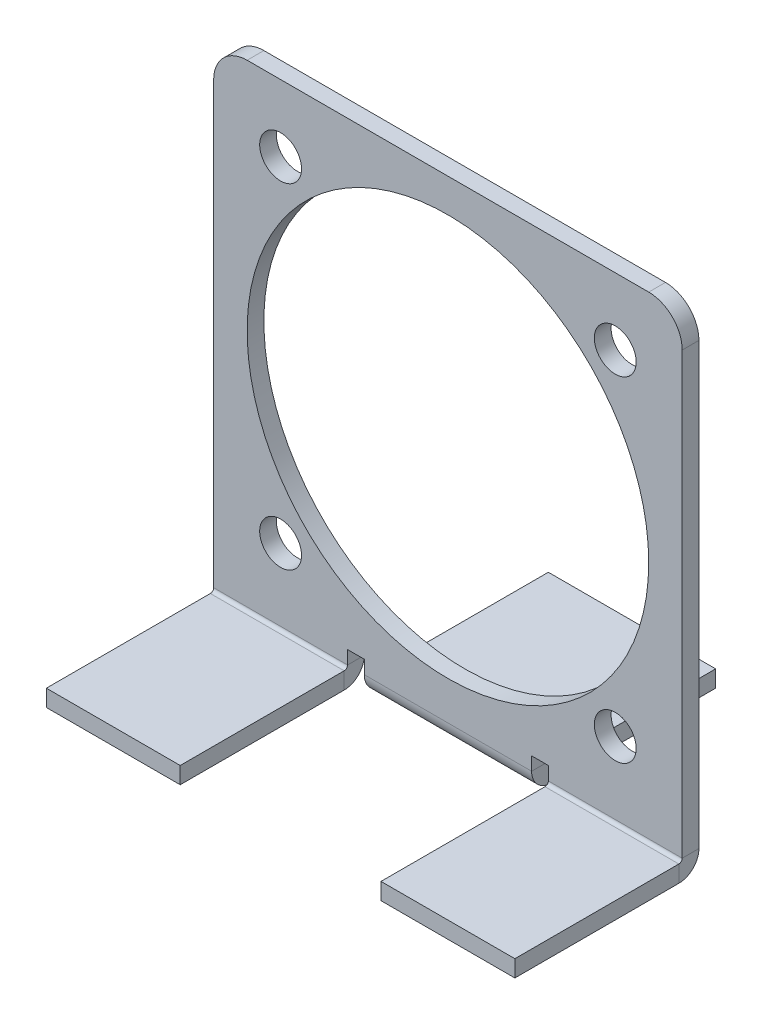
from build123d import *

# Parameters (mm, degrees)
SKIZZE1_W                       = 28
SKIZZE1_H                       = 29.5
SKIZZE1_R                       = 1.25
SKIZZE1_R_2                     = 12
BASIS_BLECH1_DEPTH              = 1
VERRUNDUNG1_R                   = 2
SKIZZE9_W                       = 1
SKIZZE9_H                       = 2
SCHNITT_LINEAR_AUSTRAGEN1_DEPTH = 33.668792448
KANTE_LASCHE2_STRIP_W           = 4.4
KANTE_LASCHE2_STRIP_H           = 1
KANTE_LASCHE2_STRIP_CUT_DEPTH   = 8
KANTE_LASCHE2_STRIP_2_W         = 4.4
KANTE_LASCHE2_STRIP_2_H         = 1
KANTE_LASCHE2_STRIP_CUT_2_DEPTH = 8
KANTE_LASCHE2_DEPTH             = 8
KANTE_LASCHE2_BEND_DEPTH        = 8
KANTE_LASCHE3_STRIP_W           = 4.4
KANTE_LASCHE3_STRIP_H           = 1
KANTE_LASCHE3_STRIP_CUT_DEPTH   = 10
KANTE_LASCHE3_DEPTH             = 10


# Sheet-metal steps are written as plain solids
with BuildPart() as part:
    # Skizze1 → Basis-Blech1 (new body)
    with BuildSketch(Plane.XY):
        with Locations((0, 14.75)):
            Rectangle(SKIZZE1_W, SKIZZE1_H)
        with Locations((-10, 25.5)):
            Circle(SKIZZE1_R, mode=Mode.SUBTRACT)
        with Locations((10, 25.5)):
            Circle(SKIZZE1_R, mode=Mode.SUBTRACT)
        with Locations((10, 5.5)):
            Circle(SKIZZE1_R, mode=Mode.SUBTRACT)
        with Locations((-10, 5.5)):
            Circle(SKIZZE1_R, mode=Mode.SUBTRACT)
        with Locations((0, 15.5)):
            Circle(SKIZZE1_R_2, mode=Mode.SUBTRACT)
    extrude(amount=-BASIS_BLECH1_DEPTH)

    # Verrundung1
    verrundung1_edges = [part.edges().sort_by_distance(p)[0] for p in [
        (-14, 29.5, -0.5),
        (14, 29.5, -0.5),
    ]]
    fillet(verrundung1_edges, radius=VERRUNDUNG1_R)

    # Skizze9 → Schnitt-Linear austragen1 (cut, through all)
    with BuildSketch(Plane.XY):
        with Locations((-5.5, 1)):
            Rectangle(SKIZZE9_W, SKIZZE9_H)
        with Locations((5.5, 1)):
            Rectangle(SKIZZE9_W, SKIZZE9_H)
    extrude(amount=-SCHNITT_LINEAR_AUSTRAGEN1_DEPTH, mode=Mode.SUBTRACT)

    # Kante-Lasche2 strip (across the edge) → Kante-Lasche2 strip cut (cut)
    with BuildSketch(Plane.YZ.offset(-14)):
        with Locations((-1, -0.5)):
            Rectangle(KANTE_LASCHE2_STRIP_W, KANTE_LASCHE2_STRIP_H)
    extrude(amount=KANTE_LASCHE2_STRIP_CUT_DEPTH, mode=Mode.SUBTRACT)

    # Kante-Lasche2 strip 2 (across the edge) → Kante-Lasche2 strip cut 2 (cut)
    with BuildSketch(Plane.YZ.offset(6)):
        with Locations((-1, -0.5)):
            Rectangle(KANTE_LASCHE2_STRIP_2_W, KANTE_LASCHE2_STRIP_2_H)
    extrude(amount=KANTE_LASCHE2_STRIP_CUT_2_DEPTH, mode=Mode.SUBTRACT)

    # Kante-Lasche2 section (across the edge) → Kante-Lasche2 (add)
    with BuildSketch(Plane.YZ.offset(-14)):
        with BuildLine():
            Line((0, 0.2), (0, 10))
            Line((0, 10), (1, 10))
            Line((1, 10), (1, 0.2))
            ThreePointArc((1, 0.2), (1.058578644, 0.058578644), (1.2, 0))
            Line((1.2, 0), (1.2, -1))
            ThreePointArc((1.2, -1), (0.351471863, -0.648528137), (0, 0.2))
        make_face()
    extrude(amount=KANTE_LASCHE2_DEPTH)

    # Kante-Lasche2 section 2 (across the edge) → Kante-Lasche2 bend (add)
    with BuildSketch(Plane.YZ.offset(6)):
        with BuildLine():
            Line((0, 0.2), (0, 10))
            Line((0, 10), (1, 10))
            Line((1, 10), (1, 0.2))
            ThreePointArc((1, 0.2), (1.058578644, 0.058578644), (1.2, 0))
            Line((1.2, 0), (1.2, -1))
            ThreePointArc((1.2, -1), (0.351471863, -0.648528137), (0, 0.2))
        make_face()
    extrude(amount=KANTE_LASCHE2_BEND_DEPTH)

    # Kante-Lasche3 strip (across the edge) → Kante-Lasche3 strip cut (cut)
    with BuildSketch(Plane(origin=(5, 0, -1), x_dir=(0, 1, 0), z_dir=(-1, 0, 0))):
        with Locations((-1, -0.5)):
            Rectangle(KANTE_LASCHE3_STRIP_W, KANTE_LASCHE3_STRIP_H)
    extrude(amount=KANTE_LASCHE3_STRIP_CUT_DEPTH, mode=Mode.SUBTRACT)

    # Kante-Lasche3 section (across the edge) → Kante-Lasche3 (add)
    with BuildSketch(Plane(origin=(5, 0, -1), x_dir=(0, 1, 0), z_dir=(-1, 0, 0))):
        with BuildLine():
            Line((0, 0.2), (0, 10))
            Line((0, 10), (1, 10))
            Line((1, 10), (1, 0.2))
            ThreePointArc((1, 0.2), (1.058578644, 0.058578644), (1.2, 0))
            Line((1.2, 0), (1.2, -1))
            ThreePointArc((1.2, -1), (0.351471863, -0.648528137), (0, 0.2))
        make_face()
    extrude(amount=KANTE_LASCHE3_DEPTH)


solid = part.part
